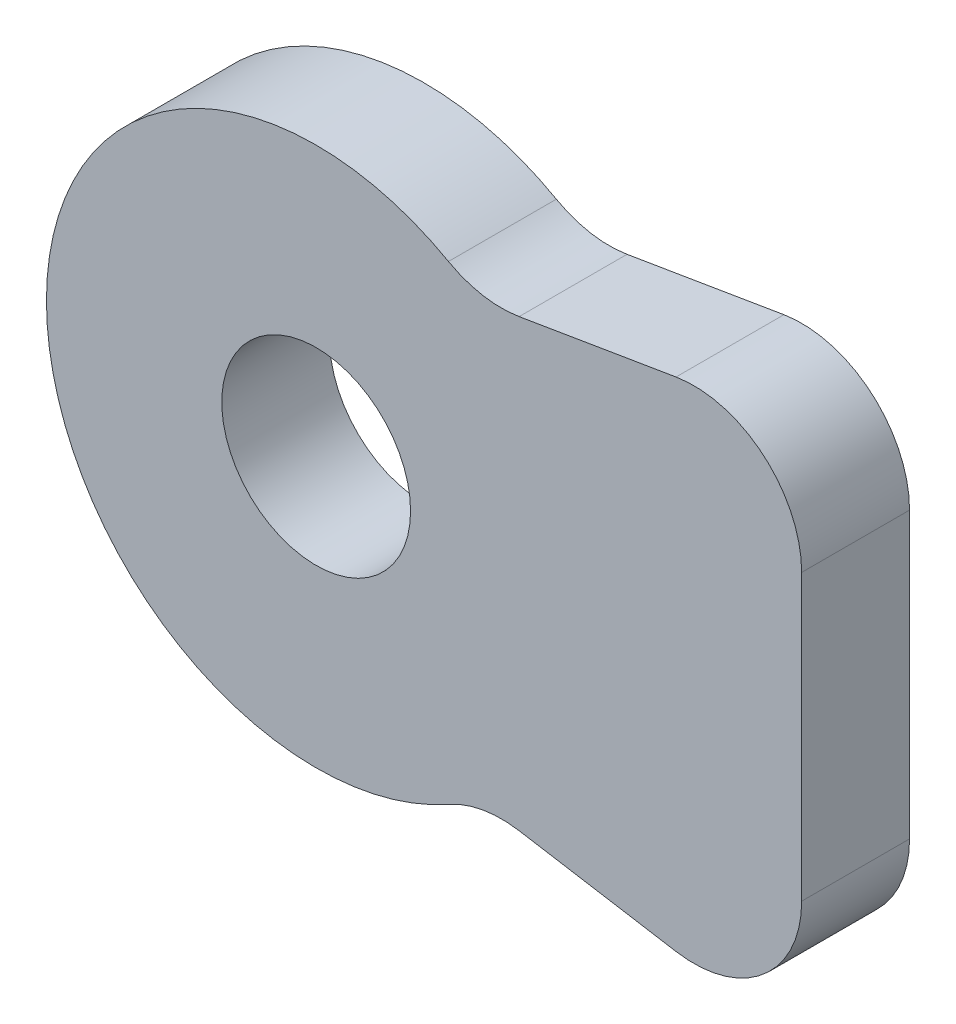
from build123d import *

# Parameters (mm, degrees)
ESQUISSE1_R        = 5
ESQUISSE1_R_2      = 1.75
BOSS_EXTRU_1_DEPTH = 2
BOSS_EXTRU_2_DEPTH = 2
CONG_1_R           = 2


with BuildPart() as part:
    # Esquisse1 → Boss.-Extru.1 (new body)
    with BuildSketch(Plane.XY):
        Circle(ESQUISSE1_R)
        Circle(ESQUISSE1_R_2, mode=Mode.SUBTRACT)
    extrude(amount=BOSS_EXTRU_1_DEPTH)

    # Esquisse2 → Boss.-Extru.2 (add)
    with BuildSketch(Plane.XY.offset(2)):
        Polygon((9, 5), (9, -5), (3, -4), (3, 4), align=None)
    extrude(amount=-BOSS_EXTRU_2_DEPTH)

    # Congé1
    cong_1_edges = [part.edges().sort_by_distance(p)[0] for p in [
        (3, -4, 1),
        (3, 4, 1),
        (9, -5, 1),
        (9, 5, 1),
    ]]
    fillet(cong_1_edges, radius=CONG_1_R)


solid = part.part
